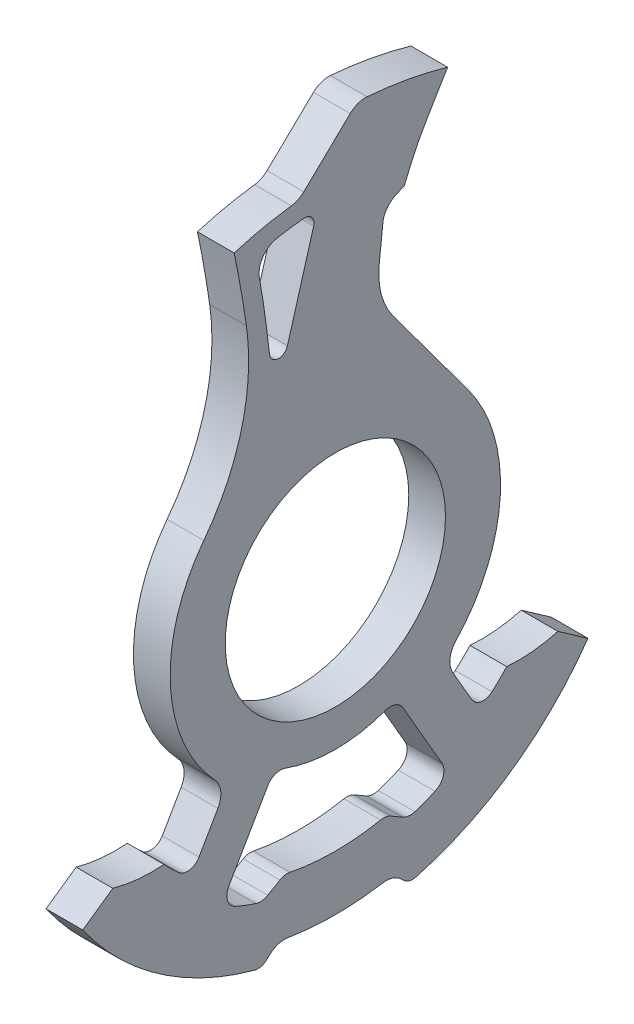
from build123d import *

# Parameters (mm, degrees)
SKETCH2_R           = 38.1
BOSS_EXTRUDE1_DEPTH = 6.35
CUT_EXTRUDE1_DEPTH  = 166.096382574
FILLET1_R           = 7.62
FILLET2_R           = 4.572
CUT_EXTRUDE2_DEPTH  = 165.922168179
FILLET3_R           = 5.08


with BuildPart() as part:
    # Sketch2 → Boss-Extrude1 (new, symmetric)
    with BuildSketch(Plane(origin=(0, 0, 0), x_dir=(0, 0, -1), z_dir=(1, 0, 0))):
        with BuildLine():
            Line((38.857972086, 134.186988957), (32.288511437, 123.318125779))
            ThreePointArc((32.288511437, 123.318125779), (27.710359244, 114.938607951), (23.879951403, 106.191964463))
            Line((23.879951403, 106.191964463), (16.910644846, 103.110866265))
            Line((16.910644846, 103.110866265), (15.162358655, 86.885756146))
            ThreePointArc((15.162358655, 86.885756146), (15.901714047, 77.516219833), (19.997572659, 69.056976407))
            Line((19.997572659, 69.056976407), (45.941860676, 33.992174653))
            ThreePointArc((45.941860676, 33.992174653), (56.822848665, -6.106256592), (37.670623819, -42.977280057))
            Line((37.670623819, -42.977280057), (49.900086632, -64.159330998))
            ThreePointArc((49.900086632, -64.159330998), (54.760018309, -60.06478831), (59.285209805, -55.603078137))
            ThreePointArc((59.285209805, -55.603078137), (68.209440684, -55.534234835), (76.983909122, -53.904713488))
            Line((76.983909122, -53.904713488), (87.387140085, -61.18913423))
            ThreePointArc((87.387140085, -61.18913423), (60.250819498, -88.036703424), (25.4, -103.612076516))
            Line((25.4, -103.612076516), (20.08663208, -98.298708596))
            ThreePointArc((20.08663208, -98.298708596), (0, -100.33), (-20.08663208, -98.298708596))
            Line((-20.08663208, -98.298708596), (-25.4, -103.612076516))
            ThreePointArc((-25.4, -103.612076516), (-60.250819498, -88.036703424), (-87.387140085, -61.18913423))
            Line((-87.387140085, -61.18913423), (-76.983909122, -53.904713488))
            ThreePointArc((-76.983909122, -53.904713488), (-68.209440684, -55.534234835), (-59.285209805, -55.603078137))
            ThreePointArc((-59.285209805, -55.603078137), (-54.760018309, -60.06478831), (-49.900086632, -64.159330998))
            Line((-49.900086632, -64.159330998), (-37.670623819, -42.977280057))
            ThreePointArc((-37.670623819, -42.977280057), (-56.860198416, -5.74807238), (-45.50982475, 34.568458908))
            ThreePointArc((-45.50982475, 34.568458908), (-32.417804081, 61.576670544), (-30.771162792, 91.545538949))
            ThreePointArc((-30.771162792, 91.545538949), (-32.69751447, 103.536635229), (-35.005069856, 115.46024244))
            ThreePointArc((-35.005069856, 115.46024244), (-23.992858561, 118.24028602), (-12.768025153, 119.972496989))
            Line((-12.768025153, 119.972496989), (7.554913188, 139.495567265))
            ThreePointArc((7.554913188, 139.495567265), (23.357744557, 137.733459149), (38.857972086, 134.186988957))
        make_face()
        Circle(SKETCH2_R, mode=Mode.SUBTRACT)
    extrude(amount=BOSS_EXTRUDE1_DEPTH, both=True)

    # Sketch3 → Cut-Extrude1 (cut, through all)
    with BuildSketch(Plane(origin=(6.35, 0, 0), x_dir=(0, 0, -1), z_dir=(1, 0, 0))):
        with BuildLine():
            Line((-7.512977292, 109.738721888), (-16.576184766, 78.441038142))
            ThreePointArc((-16.576184766, 78.441038142), (-19.901101363, 76.161124206), (-22.78229081, 78.981022307))
            ThreePointArc((-22.78229081, 78.981022307), (-24.862407335, 94.998613906), (-27.608487184, 110.915559934))
            ThreePointArc((-27.608487184, 110.915559934), (-19.289815116, 112.660521181), (-10.864472489, 113.782482121))
            ThreePointArc((-10.864472489, 113.782482121), (-8.118145596, 112.647905196), (-7.512977292, 109.738721888))
        make_face()
    extrude(amount=-CUT_EXTRUDE1_DEPTH, mode=Mode.SUBTRACT)

    # Fillet1
    fillet1_edges = [part.edges().sort_by_distance(p)[0] for p in [
        (0, 103.110866265, -16.910644846),
        (0, 110.915559934, 27.608487184),
        (0, 139.495567265, -7.554913188),
        (0, 119.972496989, 12.768025153),
        (0, -42.977280057, -37.670623819),
        (0, -42.977280057, 37.670623819),
        (0, -98.298708596, -20.08663208),
        (0, -98.298708596, 20.08663208),
    ]]
    fillet(fillet1_edges, radius=FILLET1_R)

    # Fillet2
    fillet2_edges = [part.edges().sort_by_distance(p)[0] for p in [
        (0, -103.612076516, 25.4),
        (0, -103.612076516, -25.4),
        (0, -64.159330998, -49.900086632),
        (0, -64.159330998, 49.900086632),
    ]]
    fillet(fillet2_edges, radius=FILLET2_R)

    # Sketch4 → Cut-Extrude2 (cut, through all)
    with BuildSketch(Plane(origin=(6.35, 0, 0), x_dir=(0, 0, -1), z_dir=(1, 0, 0))):
        with BuildLine():
            Line((-21.184299428, -46.172128582), (-39.645963646, -78.148669001))
            ThreePointArc((-39.645963646, -78.148669001), (-32.613253082, -81.335063923), (-25.327366164, -83.890055568))
            Line((-25.327366164, -83.890055568), (-17.5035126, -79.372951606))
            ThreePointArc((-17.5035126, -79.372951606), (-8.803547394, -80.801831373), (0, -81.28))
            Line((0, -81.28), (0, -50.8))
            ThreePointArc((0, -50.8), (-10.841952501, -49.629548315), (-21.184299428, -46.172128582))
        make_face()
    cut_extrude2 = extrude(amount=-CUT_EXTRUDE2_DEPTH, mode=Mode.SUBTRACT)

    # Mirror1: Cut-Extrude2 across plane
    add(cut_extrude2.mirror(Plane(origin=(-6.35, -81.28, 0), x_dir=(1, 0, 0), z_dir=(0, 0, -1))), mode=Mode.SUBTRACT)

    # Fillet3
    fillet3_edges = [part.edges().sort_by_distance(p)[0] for p in [
        (0, -78.148669001, -39.645963646),
        (0, -83.890055568, -25.327366164),
        (0, -79.372951606, -17.5035126),
        (0, -79.372951606, 17.5035126),
        (0, -83.890055568, 25.327366164),
        (0, -46.172128582, 21.184299428),
        (0, -46.172128582, -21.184299428),
        (0, -78.148669001, 39.645963646),
    ]]
    fillet(fillet3_edges, radius=FILLET3_R)


solid = part.part
